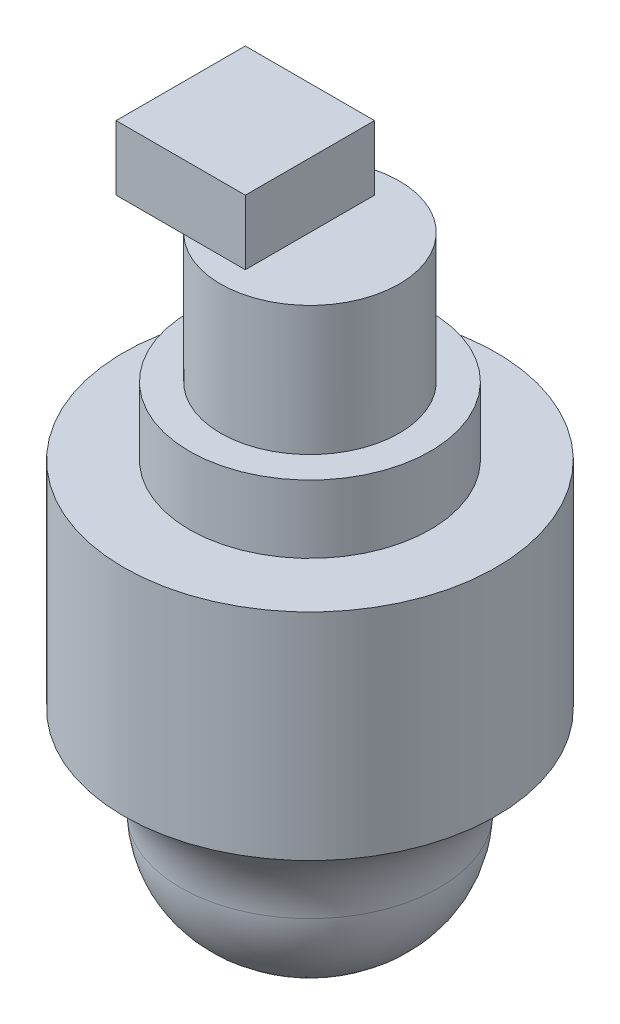
from build123d import *

# Parameters (mm, degrees)
SKETCH1_R           = 21.971
BOSS_EXTRUDE1_DEPTH = 25.4
SKETCH2_R           = 14.224
BOSS_EXTRUDE2_DEPTH = 8.001
SKETCH3_R           = 10.541
BOSS_EXTRUDE3_DEPTH = 15.24
BOSS_EXTRUDE4_DEPTH = 7.62
SKETCH5_R           = 15.24
BOSS_EXTRUDE5_DEPTH = 22.86
FILLET1_R           = 12.7
FILLET2_R           = 12.7


with BuildPart() as part:
    # Sketch1 → Boss-Extrude1 (new body)
    with BuildSketch(Plane(origin=(0, 0, 0), x_dir=(1, 0, 0), z_dir=(0, 1, 0))):
        with Locations(Location((0, 0, 0), (0, 0, 270))):
            Circle(SKETCH1_R)
    extrude(amount=BOSS_EXTRUDE1_DEPTH)

    # Sketch2 → Boss-Extrude2 (add)
    with BuildSketch(Plane(origin=(0, 25.4, 0), x_dir=(1, 0, 0), z_dir=(0, 1, 0))):
        with Locations(Location((0, 0, 0), (0, 0, 270))):
            Circle(SKETCH2_R)
    extrude(amount=BOSS_EXTRUDE2_DEPTH)

    # Sketch3 → Boss-Extrude3 (add)
    with BuildSketch(Plane(origin=(0, 33.401, 0), x_dir=(1, 0, 0), z_dir=(0, 1, 0))):
        with Locations(Location((0, 0, 0), (0, 0, 90))):
            Circle(SKETCH3_R)
    extrude(amount=BOSS_EXTRUDE3_DEPTH)

    # Sketch4 → Boss-Extrude4 (add)
    with BuildSketch(Plane(origin=(0, 48.641, 0), x_dir=(1, 0, 0), z_dir=(0, 1, 0))):
        Polygon((0, 0), (0, 7.62), (-15.24, 7.62), (-15.24, 0), (-15.24, -7.62), (0, -7.62), align=None)
    extrude(amount=BOSS_EXTRUDE4_DEPTH)

    # Sketch5 → Boss-Extrude5 (add)
    with BuildSketch(Plane.XZ):
        with Locations(Location((0, 0, 0), (0, 0, 90))):
            Circle(SKETCH5_R)
    extrude(amount=BOSS_EXTRUDE5_DEPTH)

    # Fillet1
    # the kernel refuses this fillet: 12.7 mm, written as the material it adds along each edge
    with BuildSketch(Plane(origin=(0, 0, 0), x_dir=(0, 0, 1), z_dir=(1, 0, 0))) as fillet1_piece_1:
        with BuildLine():
            CenterArc((27.94, 11.209863469), FILLET1_R, 180, 61.965703465)
            Line((15.24, 11.209863469), (14.986, 11.209863469))
            Line((14.986, 11.209863469), (14.986, 0))
            Line((14.986, 0), (15.24, -0.254))
            ThreePointArc((15.24, -0.254), (18.6055, -0.254), (21.85162, -0.224197269))
            Line((21.85162, -0.224197269), (21.971, 0))
        make_face()
    revolve(axis=Axis((0, 0, 0), (0, -1, 0)))

    # Fillet2
    fillet2_edges = [part.edges().sort_by_distance(p)[0] for p in [
        (0, -22.86, -15.24),
    ]]
    fillet(fillet2_edges, radius=FILLET2_R)


solid = part.part
